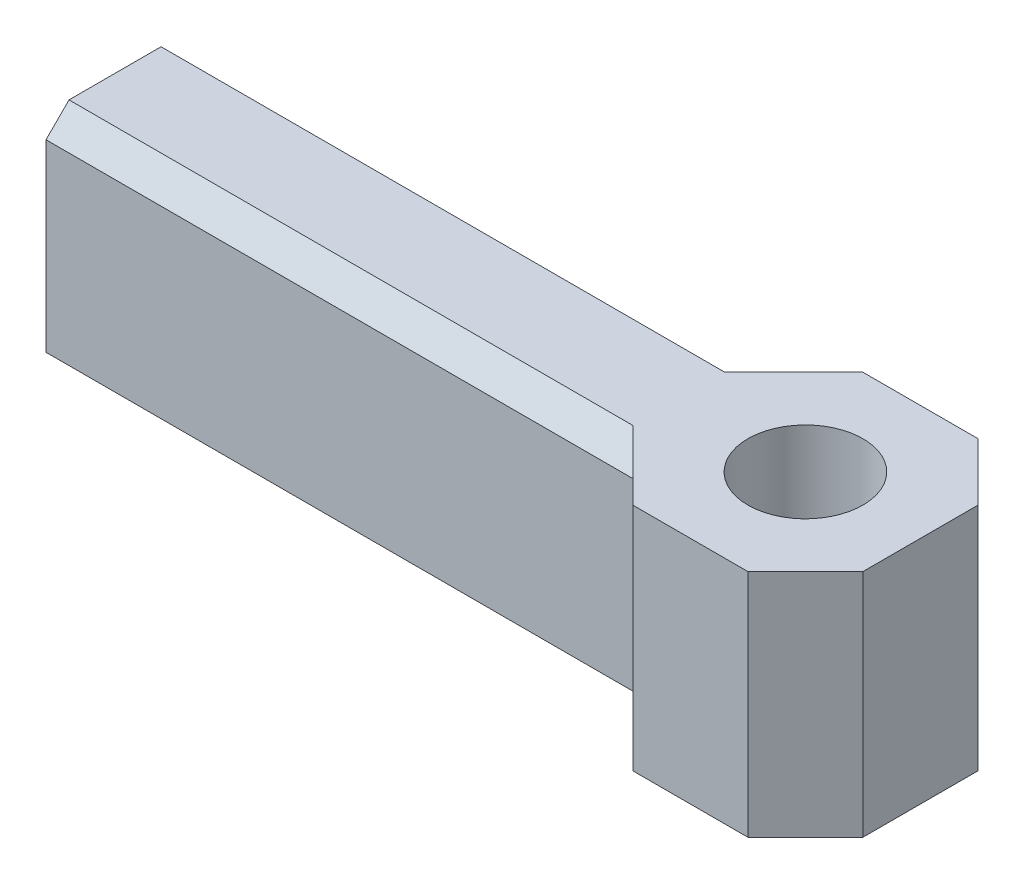
from build123d import *

# Parameters (mm, degrees)
BOSS_EXTRUDE1_DEPTH = 10
SKETCH2_R           = 2.5
CUT_EXTRUDE1_DEPTH  = 10
SKETCH4_R           = 1.7
CUT_EXTRUDE4_DEPTH  = 20
CHAMFER1_SIZE       = 2.5
CHAMFER2_SIZE       = 1


with BuildPart() as part:
    # Sketch1 → Boss-Extrude1 (new body)
    with BuildSketch(Plane(origin=(0, 0, 0), x_dir=(1, 0, 0), z_dir=(0, 1, 0))):
        Polygon((-5, 5), (-5, 3), (-30, 3), (-30, -3), (-5, -3), (-5, -5), (5, -5), (5, 5), align=None)
    extrude(amount=BOSS_EXTRUDE1_DEPTH)

    # Sketch2 → Cut-Extrude1 (cut)
    with BuildSketch(Plane(origin=(0, 10, 0), x_dir=(1, 0, 0), z_dir=(0, 1, 0))):
        with Locations(Location((0, 0, 0), (0, 0, 270))):
            Circle(SKETCH2_R)
    extrude(amount=-CUT_EXTRUDE1_DEPTH, mode=Mode.SUBTRACT)

    # Sketch4 → Cut-Extrude4 (cut)
    with BuildSketch(Plane.ZY.offset(30)):
        with Locations((0, 5)):
            Circle(SKETCH4_R)
    extrude(amount=-CUT_EXTRUDE4_DEPTH, mode=Mode.SUBTRACT)

    # Chamfer1
    # the kernel refuses this chamfer: 2.5 mm, written as the material it takes off along each edge
    with BuildSketch(Plane(origin=(5, -6.42920747, -5), x_dir=(-0.9996219169112968, 0, -0.027495876610586317), z_dir=(0, 1, 0)), Plane(origin=(5, -6.42920747, 5), x_dir=(0.027495876610586317, 0, -0.9996219169112968), z_dir=(0, 1, 0))) as chamfer1_piece_1:
        Polygon((CHAMFER1_SIZE * 0.999621916911, CHAMFER1_SIZE * 0.0274958766106), (-CHAMFER1_SIZE * 0.0274958766106, CHAMFER1_SIZE * 0.999621916911), (0, 0), align=None)
    extrude(amount=22.85841494, mode=Mode.SUBTRACT)
    with BuildSketch(Plane(origin=(-5, -6.42920747, 5), x_dir=(0.9996219169112968, 0, 0.027495876610586317), z_dir=(0, 1, 0))) as chamfer1_piece_2_section:
        Polygon((CHAMFER1_SIZE * 0.999621916911, CHAMFER1_SIZE * 0.0274958766106), (-CHAMFER1_SIZE * 0.0274958766106, CHAMFER1_SIZE * 0.999621916911), (0, 0), align=None)
    chamfer1_piece_2 = extrude(amount=22.85841494, mode=Mode.PRIVATE)
    chamfer1_piece_2 = split(chamfer1_piece_2, bisect_by=Plane(origin=(-4.135703969, 5, 3), z_dir=(0, 0, 1)), keep=Keep.TOP, mode=Mode.PRIVATE)
    add(chamfer1_piece_2, mode=Mode.SUBTRACT)
    with BuildSketch(Plane(origin=(-5, -6.42920747, -5), x_dir=(-0.027495876610588735, 0, 0.9996219169112968), z_dir=(0, 1, 0))) as chamfer1_piece_3_section:
        Polygon((CHAMFER1_SIZE * 0.999621916911, CHAMFER1_SIZE * 0.0274958766106), (-CHAMFER1_SIZE * 0.0274958766106, CHAMFER1_SIZE * 0.999621916911), (0, 0), align=None)
    chamfer1_piece_3 = extrude(amount=22.85841494, mode=Mode.PRIVATE)
    chamfer1_piece_3 = split(chamfer1_piece_3, bisect_by=Plane(origin=(-4.135703969, 5, -3), z_dir=(0, 0, -1)), keep=Keep.TOP, mode=Mode.PRIVATE)
    add(chamfer1_piece_3, mode=Mode.SUBTRACT)

    # Chamfer2
    chamfer2_edges = [part.edges().sort_by_distance(p)[0] for p in [
        (-17.25, 10, -3),
        (-17.25, 10, 3),
        (-17.25, 0, 3),
        (-17.25, 0, -3),
    ]]
    chamfer(chamfer2_edges, length=CHAMFER2_SIZE)


solid = part.part
